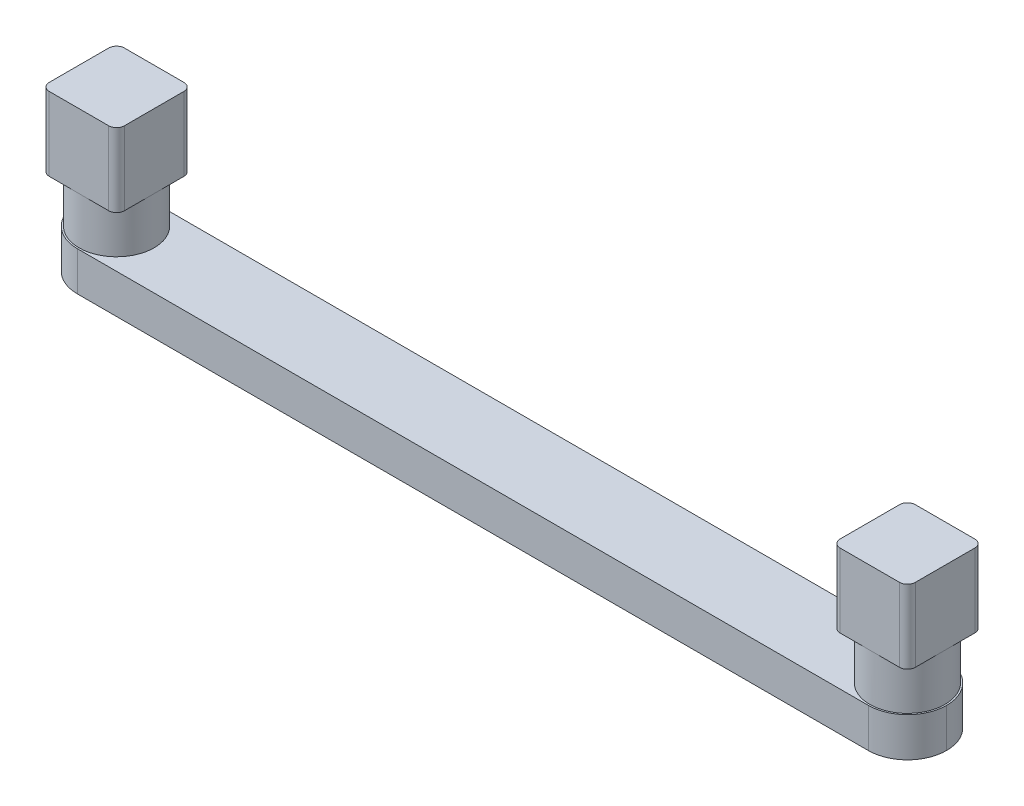
from build123d import *

# Parameters (mm, degrees)
SKETCH1_W            = 70.485
SKETCH1_H            = 6.35
BOSS_EXTRUDE1_DEPTH  = 3.175
SKETCH2_R            = 3.048
BOSS_EXTRUDE2_DEPTH  = 3.81
SKETCH3_W            = 6.096
SKETCH3_H            = 6.096
BOSS_EXTRUDE3_DEPTH  = 5.969
FILLET1_R            = 3.175
FILLET2_R            = 0.635
FILLET2_OF_MIRROR1_R = 0.635


with BuildPart() as part:
    # Sketch1 → Boss-Extrude1 (new body)
    with BuildSketch(Plane(origin=(0, 0, 0), x_dir=(1, 0, 0), z_dir=(0, 1, 0))):
        Rectangle(SKETCH1_W, SKETCH1_H)
    extrude(amount=BOSS_EXTRUDE1_DEPTH)

    # Sketch2 → Boss-Extrude2 (add)
    with BuildSketch(Plane(origin=(0, 3.175, 0), x_dir=(1, 0, 0), z_dir=(0, 1, 0))):
        with Locations(Location((32.0675, 0, 0), (0, 0, 90))):
            Circle(SKETCH2_R)
    boss_extrude2 = extrude(amount=BOSS_EXTRUDE2_DEPTH)

    # Sketch3 → Boss-Extrude3 (add)
    with BuildSketch(Plane(origin=(0, 6.985, 0), x_dir=(1, 0, 0), z_dir=(0, 1, 0))):
        with Locations((32.0675, 0)):
            Rectangle(SKETCH3_W, SKETCH3_H)
    boss_extrude3 = extrude(amount=BOSS_EXTRUDE3_DEPTH)

    # Fillet1
    fillet1_edges = [part.edges().sort_by_distance(p)[0] for p in [
        (-35.2425, 1.5875, 3.175),
        (-35.2425, 1.5875, -3.175),
        (35.2425, 1.5875, 3.175),
        (35.2425, 1.5875, -3.175),
    ]]
    fillet(fillet1_edges, radius=FILLET1_R - 0.0001)  # a hair under: the kernel refuses the full size

    # Fillet2
    fillet2_edges = [part.edges().sort_by_distance(p)[0] for p in [
        (35.1155, 9.9695, 3.048),
        (35.1155, 9.9695, -3.048),
        (29.0195, 9.9695, -3.048),
        (29.0195, 9.9695, 3.048),
    ]]
    fillet(fillet2_edges, radius=FILLET2_R)

    # Mirror1: Boss-Extrude2, Boss-Extrude3 across plane
    add(boss_extrude2.mirror(Plane(origin=(0, 0, 0), x_dir=(0, 0, 1), z_dir=(1, 0, 0))))
    add(boss_extrude3.mirror(Plane(origin=(0, 0, 0), x_dir=(0, 0, 1), z_dir=(1, 0, 0))))

    # Fillet2 of Mirror1
    fillet2_of_mirror1_edges = [part.edges().sort_by_distance(p)[0] for p in [
        (-35.1155, 9.9695, 3.048),
        (-35.1155, 9.9695, -3.048),
        (-29.0195, 9.9695, -3.048),
        (-29.0195, 9.9695, 3.048),
    ]]
    fillet(fillet2_of_mirror1_edges, radius=FILLET2_OF_MIRROR1_R)


solid = part.part
